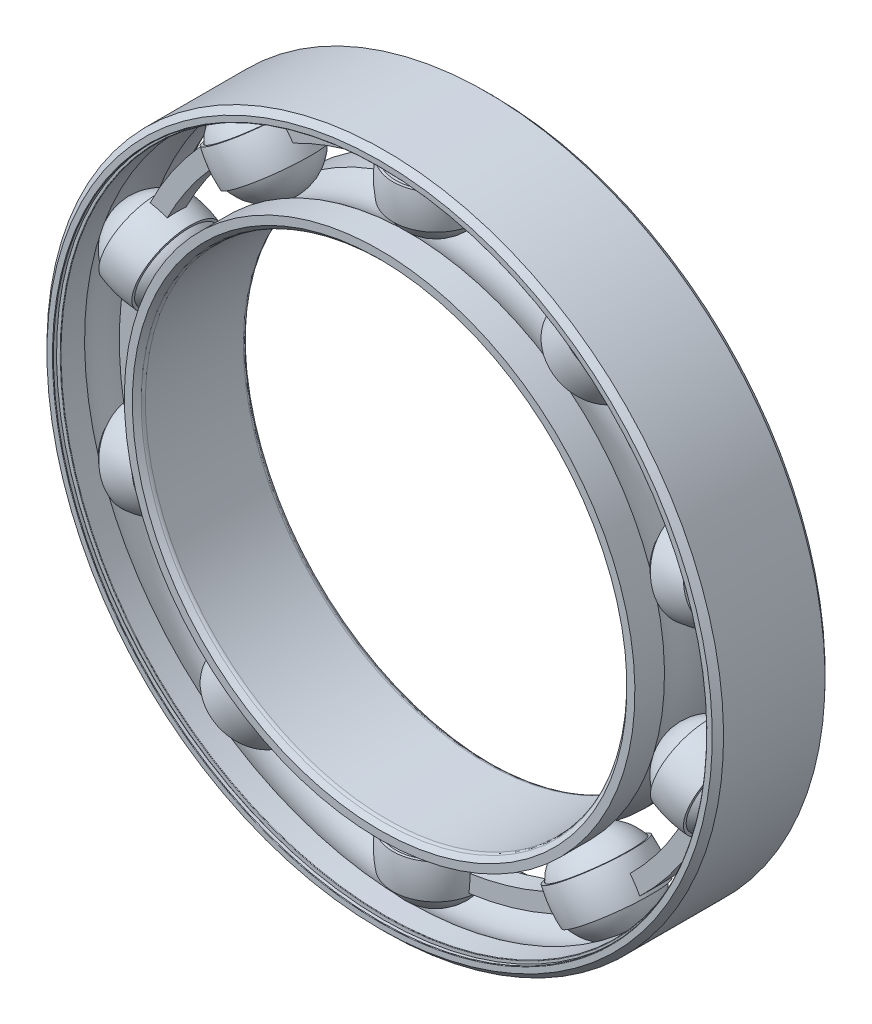
from build123d import *

# Parameters (mm, degrees)
BOSS_EXTRUDE1_DEPTH = 0.583333333
CIRPATTERN1_ANGLE   = 36
CIRPATTERN1_2_ANGLE = 72
CIRPATTERN1_3_ANGLE = 108
CIRPATTERN1_4_ANGLE = 144
CIRPATTERN1_5_ANGLE = 180
CIRPATTERN1_6_ANGLE = 144
CIRPATTERN1_7_ANGLE = 108
CIRPATTERN1_8_ANGLE = 72
CIRPATTERN1_9_ANGLE = 36
CIRPATTERN2_COUNT   = 10
FILLET1_R           = 0.0315
FILLET2_R           = 0.2625


with BuildPart() as part:
    # Sketch3 → Revolve1 (revolve)
    with BuildSketch(Plane(origin=(0, 0, 0), x_dir=(0, 0, -1), z_dir=(1, 0, 0)), mode=Mode.PRIVATE) as revolve1_sk:
        with BuildLine():
            Line((3.15, 21), (3.5, 20.65))
            Line((3.5, 20.65), (3.5, 20.153596154))
            Line((3.5, 20.153596154), (1.6625, 20.153596154))
            ThreePointArc((1.6625, 20.153596154), (0, 20.720588015), (-1.6625, 20.153596154))
            Line((-1.6625, 20.153596154), (-3.5, 20.153596154))
            Line((-3.5, 20.153596154), (-3.5, 20.65))
            Line((-3.5, 20.65), (-3.15, 21))
            Line((-3.15, 21), (3.15, 21))
        make_face()
    revolve(revolve1_sk.sketch.rotate(Axis((0, 0, 3.5), (0, 0, -1)), 180), axis=Axis((0, 0, 3.5), (0, 0, -1)))

    # Sketch8 → Cut-Revolve1 (revolve, cut)
    with BuildSketch(Plane(origin=(0, 0, 0), x_dir=(0, 0, -1), z_dir=(1, 0, 0)), mode=Mode.PRIVATE) as cut_revolve1_sk:
        Polygon((-3.276, 20.153596154), (-3.15, 20.153596154), (-3.15, 20.435730769), (-3.276, 20.435730769), (-3.276, 20.279596154), (-3.5, 20.279596154), (-3.5, 20.153596154), align=None)
        Polygon((3.15, 20.153596154), (3.276, 20.153596154), (3.5, 20.153596154), (3.5, 20.279596154), (3.276, 20.279596154), (3.276, 20.435730769), (3.15, 20.435730769), align=None)
    revolve(cut_revolve1_sk.sketch.rotate(Axis((0, 0, 3.5), (0, 0, -1)), 180), axis=Axis((0, 0, 3.5), (0, 0, -1)), mode=Mode.SUBTRACT)

    # Fillet1
    fillet1_edges = [part.edges().sort_by_distance(p)[0] for p in [
        (0, 20.279596154, 3.5),
        (0, 20.153596154, 3.15),
        (0, 20.279596154, -3.5),
        (0, 20.153596154, -3.15),
    ]]
    fillet(fillet1_edges, radius=FILLET1_R)


with BuildPart() as body_2:
    # Sketch4 → Revolve2 (revolve)
    with BuildSketch(Plane(origin=(0, 0, 0), x_dir=(0, 0, -1), z_dir=(1, 0, 0)), mode=Mode.PRIVATE) as revolve2_sk:
        with BuildLine():
            Line((-3.15, 14.9995), (-3.5, 15.3495))
            Line((-3.5, 15.3495), (-3.5, 15.845903846))
            Line((-3.5, 15.845903846), (-1.6625, 15.845903846))
            ThreePointArc((-1.6625, 15.845903846), (0, 15.278911985), (1.6625, 15.845903846))
            Line((1.6625, 15.845903846), (3.5, 15.845903846))
            Line((3.5, 15.845903846), (3.5, 15.3495))
            Line((3.5, 15.3495), (3.15, 14.9995))
            Line((3.15, 14.9995), (-3.15, 14.9995))
        make_face()
    revolve(revolve2_sk.sketch.rotate(Axis((0, 0, 3.5), (0, 0, -1)), 180), axis=Axis((0, 0, 3.5), (0, 0, -1)))

    # Fillet2
    fillet2_edges = [body_2.edges().sort_by_distance(p)[0] for p in [
        (0, 14.9995, 3.15),
        (0, 14.9995, -3.15),
    ]]
    fillet(fillet2_edges, radius=FILLET2_R)


with BuildPart() as body_3:
    # Sketch5 → Revolve3 (revolve)
    with BuildSketch(Plane(origin=(0, 0, 0), x_dir=(0, 0, -1), z_dir=(1, 0, 0))):
        with BuildLine():
            Line((-2.720838015, 17.99975), (2.720838015, 17.99975))
            ThreePointArc((2.720838015, 17.99975), (0, 20.720588015), (-2.720838015, 17.99975))
        make_face()
    revolve(axis=Axis((0, 17.99975, 2.720838015), (0, 0, -1)))


with BuildPart() as body_4:
    # Sketch6 → Revolve4 (revolve)
    with BuildSketch(Plane(origin=(0, 0, 0), x_dir=(0, 0, -1), z_dir=(1, 0, 0))):
        with BuildLine():
            Line((-2.498638868, 19.076673077), (-2.66553239, 19.076673077))
            ThreePointArc((-2.66553239, 19.076673077), (-2.748979151, 17.99975), (-2.66553239, 16.922826923))
            Line((-2.66553239, 16.922826923), (-2.498638868, 16.922826923))
            ThreePointArc((-2.498638868, 16.922826923), (-2.720838015, 17.99975), (-2.498638868, 19.076673077))
        make_face()
    revolve4 = revolve(axis=Axis((0, 21, 0), (0, -1, 0)))

    # Sketch7 → Boss-Extrude1 (add, symmetric)
    with BuildSketch(Plane.XY):
        with BuildLine():
            Line((10.8619198, 14.353037948), (11.511787275, 15.211778641))
            ThreePointArc((11.511787275, 15.211778641), (6.071627773, 18.084656255), (0, 19.076673077))
            Line((0, 19.076673077), (0, 17.99975))
            ThreePointArc((0, 17.99975), (5.728870101, 17.063734862), (10.8619198, 14.353037948))
        make_face()
    boss_extrude1 = extrude(amount=BOSS_EXTRUDE1_DEPTH, both=True)

    # CirPattern2: Revolve4, Boss-Extrude1 ×10 about axis
    cirpattern2_axis = Axis((0, 0, 0), (0, 0, 1))
    add([revolve4.rotate(cirpattern2_axis, i * 360 / CIRPATTERN2_COUNT) for i in range(1, CIRPATTERN2_COUNT)])
    add([boss_extrude1.rotate(cirpattern2_axis, i * 360 / CIRPATTERN2_COUNT) for i in range(1, CIRPATTERN2_COUNT)])


with BuildPart() as body_5:
    # CirPattern1: read off the stored shape, not the designer's step
    # CirPattern1: copy of body 3
    add(body_3.part.rotate(Axis((0, 0, 0), (0, 0, 1)), CIRPATTERN1_ANGLE))


with BuildPart() as body_6:
    # CirPattern1 2: copy of body 3
    add(body_3.part.rotate(Axis((0, 0, 0), (0, 0, 1)), CIRPATTERN1_2_ANGLE))


with BuildPart() as body_7:
    # CirPattern1 3: copy of body 3
    add(body_3.part.rotate(Axis((0, 0, 0), (0, 0, 1)), CIRPATTERN1_3_ANGLE))


with BuildPart() as body_8:
    # CirPattern1 4: copy of body 3
    add(body_3.part.rotate(Axis((0, 0, 0), (0, 0, 1)), CIRPATTERN1_4_ANGLE))


with BuildPart() as body_9:
    # CirPattern1 5: copy of body 3
    add(body_3.part.rotate(Axis((0, 0, 0), (0, 0, 1)), CIRPATTERN1_5_ANGLE))


with BuildPart() as body_10:
    # CirPattern1 6: copy of body 3
    add(body_3.part.rotate(Axis((0, 0, 0), (0, 0, -1)), CIRPATTERN1_6_ANGLE))


with BuildPart() as body_11:
    # CirPattern1 7: copy of body 3
    add(body_3.part.rotate(Axis((0, 0, 0), (0, 0, -1)), CIRPATTERN1_7_ANGLE))


with BuildPart() as body_12:
    # CirPattern1 8: copy of body 3
    add(body_3.part.rotate(Axis((0, 0, 0), (0, 0, -1)), CIRPATTERN1_8_ANGLE))


with BuildPart() as body_13:
    # CirPattern1 9: copy of body 3
    add(body_3.part.rotate(Axis((0, 0, 0), (0, 0, -1)), CIRPATTERN1_9_ANGLE))


solid = Compound([part.part, body_2.part, body_3.part, body_4.part, body_5.part, body_6.part, body_7.part, body_8.part, body_9.part, body_10.part, body_11.part, body_12.part, body_13.part])
